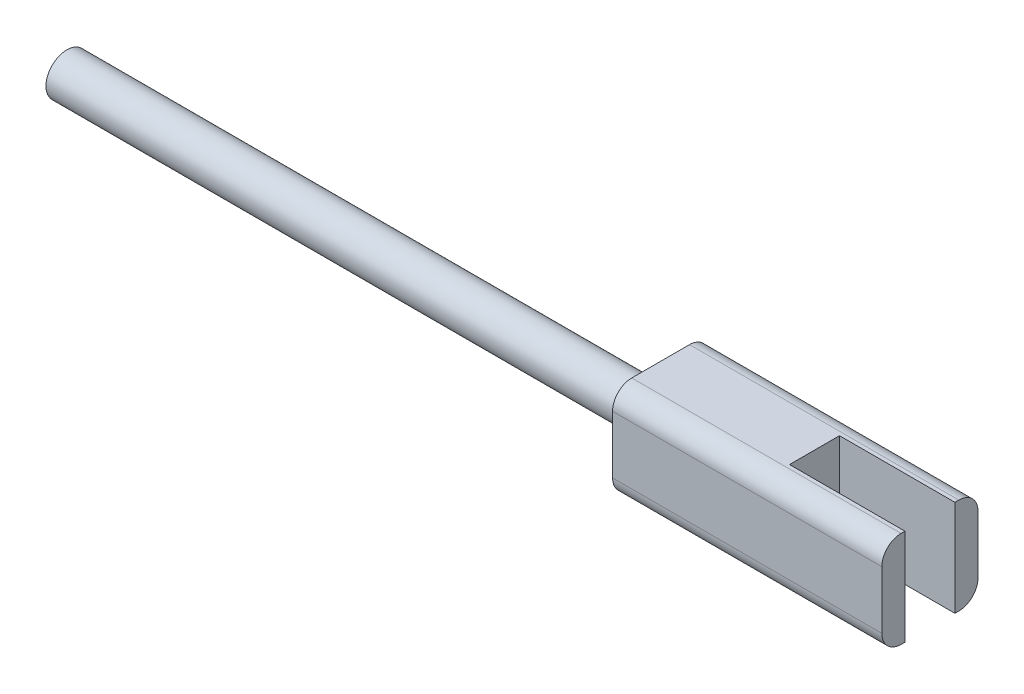
from build123d import *

# Parameters (mm, degrees)
SKETCH1_R               = 1.09
BOSS_EXTRUDE1_DEPTH     = 32.87
BOSS_EXTRUDE2_DEPTH     = 14
CUT_EXTRUDE1_DEPTH      = 46.009075751
CUT_EXTRUDE1_DEPTH_BACK = 46.009075751
SKETCH3_W               = 7
SKETCH3_H               = 2.6


with BuildPart() as part:
    # Sketch1 → Boss-Extrude1 (new body)
    with BuildSketch(Plane(origin=(0, 0, 0), x_dir=(0, 0, -1), z_dir=(1, 0, 0))):
        Circle(SKETCH1_R)
    extrude(amount=BOSS_EXTRUDE1_DEPTH)

    # Sketch2 → Boss-Extrude2 (add)
    with BuildSketch(Plane(origin=(30.87, 0, 0), x_dir=(0, 0, -1), z_dir=(1, 0, 0))):
        with BuildLine():
            Line((-1.5, -2.5), (1.5, -2.5))
            ThreePointArc((1.5, -2.5), (2.207106781, -2.207106781), (2.5, -1.5))
            Line((2.5, -1.5), (2.5, 1.5))
            ThreePointArc((2.5, 1.5), (2.207106781, 2.207106781), (1.5, 2.5))
            Line((1.5, 2.5), (-1.5, 2.5))
            ThreePointArc((-1.5, 2.5), (-2.207106781, 2.207106781), (-2.5, 1.5))
            Line((-2.5, 1.5), (-2.5, -1.5))
            ThreePointArc((-2.5, -1.5), (-2.207106781, -2.207106781), (-1.5, -2.5))
        make_face()
    extrude(amount=BOSS_EXTRUDE2_DEPTH)

    # Sketch3 → Cut-Extrude1 (cut, two sides: drawn at the far end of the back side and taken through both)
    with BuildSketch(Plane(origin=(0, 0, 0), x_dir=(1, 0, 0), z_dir=(0, 1, 0)).offset(-CUT_EXTRUDE1_DEPTH_BACK)):
        with Locations((42.37, 0)):
            Rectangle(SKETCH3_W, SKETCH3_H)
    extrude(amount=CUT_EXTRUDE1_DEPTH + CUT_EXTRUDE1_DEPTH_BACK, mode=Mode.SUBTRACT)


solid = part.part
